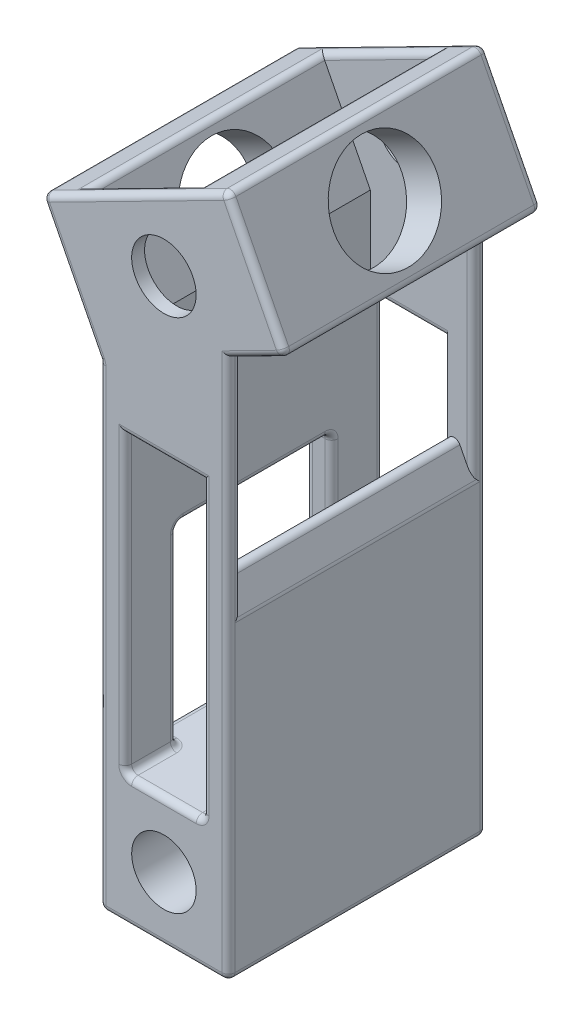
from build123d import *

# Parameters (mm, degrees)
BOSS_EXTRUDE1_DEPTH = 20
CUT_EXTRUDE1_REACH  = 38.702
SKETCH2_R           = 2.5
SKETCH5_W           = 10
SKETCH5_H           = 18
CUT_EXTRUDE4_DEPTH  = 54.272627403
SKETCH6_R           = 4
CUT_EXTRUDE5_DEPTH  = 46.762260698
SKETCH8_W           = 6
SKETCH8_H           = 22.840741565
CUT_EXTRUDE6_DEPTH  = 37.702076275
SKETCH12_W          = 3.539135452
SKETCH12_H          = 18
CUT_EXTRUDE7_DEPTH  = 41.024339686
CUT_EXTRUDE8_REACH  = 39.827
SKETCH13_W          = 12
SKETCH13_H          = 14.840741565
FILLET2_R           = 0.5


with BuildPart() as part:
    # Sketch1 → Boss-Extrude1 (new body)
    with BuildSketch(Plane.XY):
        Polygon((-3.287943452, 12.452372753), (-3.287943452, -24.388368812), (6.712056548, -24.388368812), (6.712056548, 17.547627247), (11.11006124, 19.788522565), (6.570156243, 28.698587807), (-7.827848449, 21.362437994), align=None)
    extrude(amount=BOSS_EXTRUDE1_DEPTH)

    # Sketch2 → Cut-Extrude1 (cut, up to next)
    with BuildSketch(Plane(origin=(0, 0, 0), x_dir=(-1, 0, 0), z_dir=(0, 0, -1)), mode=Mode.PRIVATE) as cut_extrude1_sk1:
        with Locations((-1.712056548, -19.388368812)):
            Circle(SKETCH2_R)
    cut_extrude1_tool1 = extrude(cut_extrude1_sk1.sketch, amount=-CUT_EXTRUDE1_REACH, mode=Mode.PRIVATE) & part.part
    # Sketch2 → Cut-Extrude1 (cut, up to next)
    with BuildSketch(Plane(origin=(0, 0, 0), x_dir=(-1, 0, 0), z_dir=(0, 0, -1)), mode=Mode.PRIVATE) as cut_extrude1_sk2:
        with Locations((-1.712056548, 20.611631188)):
            Circle(SKETCH2_R)
    cut_extrude1_tool2 = extrude(cut_extrude1_sk2.sketch, amount=-CUT_EXTRUDE1_REACH, mode=Mode.PRIVATE) & part.part
    add(cut_extrude1_tool1.solids().sort_by_distance((1.712057, -19.388369, 0))[0], mode=Mode.SUBTRACT)
    add(cut_extrude1_tool2.solids().sort_by_distance((1.712057, 20.611631, 0))[0], mode=Mode.SUBTRACT)

    # Sketch5 → Cut-Extrude4 (cut, through all)
    with BuildSketch(Plane(origin=(-10.254664976, 20.125913213, 0), x_dir=(0.891006524188368, 0.4539904997395467, 0), z_dir=(-0.4539904997395467, 0.891006524188368, 0))):
        with Locations((10.843123689, -10)):
            Rectangle(SKETCH5_W, SKETCH5_H)
    extrude(amount=-CUT_EXTRUDE4_DEPTH, mode=Mode.SUBTRACT)

    # Sketch6 → Cut-Extrude5 (cut, through all)
    with BuildSketch(Plane(origin=(16.824821219, 8.572674594, 0), x_dir=(0, 0, -1), z_dir=(0.891006524188368, 0.45399049973954647, 0))):
        with Locations(Location((-10, 17.587840455, 0), (0, 0, 90))):
            Circle(SKETCH6_R)
    extrude(amount=-CUT_EXTRUDE5_DEPTH, mode=Mode.SUBTRACT)

    # Sketch8 → Cut-Extrude6 (cut, through all)
    with BuildSketch(Plane.XY.offset(20)):
        with Locations((1.712056548, -2.96799803)):
            Rectangle(SKETCH8_W, SKETCH8_H)
    extrude(amount=-CUT_EXTRUDE6_DEPTH, mode=Mode.SUBTRACT)

    # Sketch12 → Cut-Extrude7 (cut, through all)
    with BuildSketch(Plane.XZ.offset(-8.452372753)):
        with Locations((0.481624274, 10)):
            Rectangle(SKETCH12_W, SKETCH12_H)
    extrude(amount=-CUT_EXTRUDE7_DEPTH, mode=Mode.SUBTRACT)

    # Sketch13 → Cut-Extrude8 (cut, up to next)
    with BuildSketch(Plane.ZY.offset(3.287943452), mode=Mode.PRIVATE) as cut_extrude8_sk1:
        with Locations((10, -6.96799803)):
            Rectangle(SKETCH13_W, SKETCH13_H)
    cut_extrude8_tool1 = extrude(cut_extrude8_sk1.sketch, amount=-CUT_EXTRUDE8_REACH, mode=Mode.PRIVATE) & part.part
    add(cut_extrude8_tool1.solids().sort_by_distance((-3.287943, -6.967998, 10))[0], mode=Mode.SUBTRACT)

    # Fillet2
    fillet2_edges = [part.edges().sort_by_distance(p)[0] for p in [
        (-2.287943452, -14.388368812, 4),
        (-1.287943452, -14.388368812, 18),
        (-1.287943452, -14.388368812, 2),
        (4.712056548, -14.388368812, 10),
        (-1.287943452, -6.96799803, 4),
        (-2.287943452, 0.452372753, 4),
        (-1.287943452, 0.452372753, 10),
        (-2.287943452, 0.452372753, 16),
        (-2.287943452, -14.388368812, 16),
        (-1.287943452, -6.96799803, 16),
        (1.712056548, 8.452372753, 19),
        (1.712056548, 8.452372753, 0),
        (1.712056548, 8.452372753, 1),
        (4.712056548, -2.96799803, 0),
        (-1.287943452, -2.96799803, 0),
        (1.712056548, -14.388368812, 0),
        (1.712056548, 8.452372753, 20),
        (4.712056548, -2.96799803, 20),
        (1.712056548, -14.388368812, 20),
        (-1.287943452, -2.96799803, 20),
        (-3.287943452, -14.388368812, 10),
        (-3.287943452, -6.96799803, 4),
        (-3.287943452, 0.452372753, 10),
        (-3.287943452, -6.96799803, 16),
        (1.712056548, -24.388368812, 20),
        (1.712056548, -24.388368812, 0),
        (-3.287943452, -24.388368812, 10),
        (-3.287943452, -5.96799803, 20),
        (-5.55789595, 16.907405373, 20),
        (-3.287943452, 12.452372753, 10),
        (-5.55789595, 16.907405373, 0),
        (-3.287943452, -5.96799803, 0),
        (-0.628846103, 25.030512901, 20),
        (-0.593371027, 25.048588355, 19),
        (-5.048403648, 22.778635856, 10),
        (-7.827848449, 21.362437994, 10),
        (-0.628846103, 25.030512901, 0),
        (-0.593371027, 25.048588355, 1),
        (3.861661594, 27.318540854, 10),
        (6.570156243, 28.698587807, 10),
        (8.840108742, 24.243555186, 20),
        (8.840108742, 24.243555186, 0),
        (11.11006124, 19.788522565, 10),
        (7.55681157, 17.97805143, 19),
        (8.911058894, 18.668074906, 20),
        (7.55681157, 17.97805143, 1),
        (8.401566592, 18.408475612, 10),
        (6.712056548, 8.622530187, 1),
        (4.712056548, 6.037513445, 19),
        (6.712056548, 8.622530187, 19),
        (4.712056548, 3.622654137, 10),
        (6.712056548, -0.302566874, 10),
        (8.911058894, 18.668074906, 0),
        (6.712056548, -3.420370782, 0),
        (6.712056548, -24.388368812, 10),
        (6.712056548, -3.420370782, 20),
    ]]
    fillet(fillet2_edges, radius=FILLET2_R - 0.0001)  # a hair under: the kernel refuses the full size


solid = part.part
